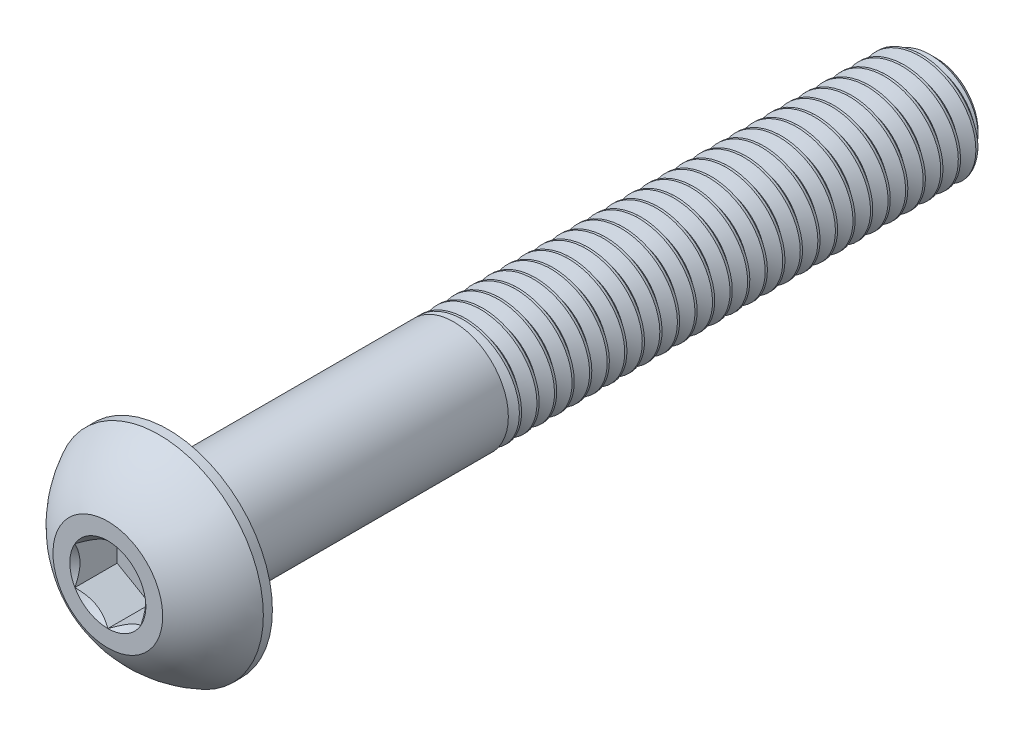
from build123d import *
from build123d.topology import SkipClean

# Parameters (mm, degrees)
SKETCH1_W           = 35
SKETCH1_H           = 2.5
CHAMFER1_SIZE       = 0.6
CUT_SWEEP1_PITCH    = 0.8
CUT_EXTRUDE2_DEPTH  = 1.925
BOSS_EXTRUDE2_START = -13
SKETCH9_R           = 2.5
BOSS_EXTRUDE2_DEPTH = 13


with BuildPart() as part:
    # Sketch1 → Revolve1 (revolve)
    with BuildSketch(Plane(origin=(0, 0, 0), x_dir=(0, 0, -1), z_dir=(1, 0, 0))):
        with Locations((20.25, 1.25)):
            Rectangle(SKETCH1_W, SKETCH1_H)
    revolve(axis=Axis((0, 0, -37.75), (0, 0, 1)))

    # Chamfer1
    chamfer1_edges = [part.edges().sort_by_distance(p)[0] for p in [
        (0, -2.5, -37.75),
    ]]
    chamfer(chamfer1_edges, length=CHAMFER1_SIZE)

    # Cut-Sweep1: arcs per turn and ends read off the stored shape
    # Cut-Sweep1: the profile of Sketch2 profile screwed along a right-hand helix through 44.75 turns, 8 arcs to a turn; built about Z, then put on its axis
    cut_sweep1_z = Axis((0, 0, 0), (0, 0, 1))
    cut_sweep1_corners = [(2.5003, 0, 0.000173205), (2.5003, 0, -0.700173205), (1.980384758, 0, -0.4), (1.980384758, 0, -0.3)]
    with BuildLine(mode=Mode.PRIVATE) as cut_sweep1_profile:
        Line(cut_sweep1_corners[0], cut_sweep1_corners[1])
        Line(cut_sweep1_corners[1], cut_sweep1_corners[2])
        Line(cut_sweep1_corners[2], cut_sweep1_corners[3])
        Line(cut_sweep1_corners[3], cut_sweep1_corners[0])
    cut_sweep1_cap = Face(cut_sweep1_profile.wire())
    cut_sweep1_turn_angles = [0, 22.5, 45, 67.5, 90, 112.5, 135, 157.5, 180, 202.5, 225, 247.5, 270, 292.5, 315, 337.5, 360]
    cut_sweep1_turn_weights = [1, 0.9238795325112867, 1, 0.9238795325112867, 1, 0.9238795325112867, 1, 0.9238795325112867, 1, 0.9238795325112867, 1, 0.9238795325112867, 1, 0.9238795325112867, 1, 0.9238795325112867, 1]
    cut_sweep1_turn_rails = [Edge.make_bspline([Vector(p[0], p[1], 0).rotate(cut_sweep1_z, cut_sweep1_turn_angles[k]) / cut_sweep1_turn_weights[k] + Vector(0, 0, p[2] + CUT_SWEEP1_PITCH * cut_sweep1_turn_angles[k] / 360) for k in range(17)], [0, 0, 0, 1, 1, 2, 2, 3, 3, 4, 4, 5, 5, 6, 6, 7, 7, 8, 8, 8], 2, cut_sweep1_turn_weights) for p in cut_sweep1_corners]
    cut_sweep1_turn_sides = [Face.make_surface_from_curves(cut_sweep1_turn_rails[p[0]], cut_sweep1_turn_rails[p[1]]) for p in [(0, 1), (1, 2), (2, 3), (3, 0)]]
    cut_sweep1_last_angles = [15840, 15862.5, 15885, 15907.5, 15930, 15952.5, 15975, 15997.5, 16020, 16042.5, 16065, 16087.5, 16110]
    cut_sweep1_last_weights = [1, 0.9238795325112867, 1, 0.9238795325112867, 1, 0.9238795325112867, 1, 0.9238795325112867, 1, 0.9238795325112867, 1, 0.923879532511633, 1]
    cut_sweep1_last_rails = [Edge.make_bspline([Vector(p[0], p[1], 0).rotate(cut_sweep1_z, cut_sweep1_last_angles[k]) / cut_sweep1_last_weights[k] + Vector(0, 0, p[2] + CUT_SWEEP1_PITCH * cut_sweep1_last_angles[k] / 360) for k in range(13)], [0, 0, 0, 1, 1, 2, 2, 3, 3, 4, 4, 5, 5, 6, 6, 6], 2, cut_sweep1_last_weights) for p in cut_sweep1_corners]
    cut_sweep1_last_sides = [Face.make_surface_from_curves(cut_sweep1_last_rails[p[0]], cut_sweep1_last_rails[p[1]]) for p in [(0, 1), (1, 2), (2, 3), (3, 0)]]
    cut_sweep1 = Plane(origin=(0, 0, -37.75), x_dir=(0, 1, 0), z_dir=(0, 0, 1)) * Solid(Shell([*[p.moved(Location((0, 0, CUT_SWEEP1_PITCH * i))) for i in range(44) for p in cut_sweep1_turn_sides], *cut_sweep1_last_sides, cut_sweep1_cap, cut_sweep1_cap.rotate(cut_sweep1_z, 16110).moved(Location((0, 0, CUT_SWEEP1_PITCH * 16110 / 360)))]))
    add(cut_sweep1, mode=Mode.SUBTRACT)

    # Sketch7 → Revolve2 (revolve)
    with BuildSketch(Plane(origin=(0, 0, 0), x_dir=(0, 0, -1), z_dir=(1, 0, 0))):
        with BuildLine():
            Line((2.3375, 4.75), (2.75, 4.75))
            Line((2.75, 4.75), (2.75, 0))
            Line((2.75, 0), (0, 0))
            Line((0, 0), (0, 2.5))
            ThreePointArc((0, 2.5), (0.991875183, 3.808753282), (2.3375, 4.75))
        make_face()
    revolve(axis=Axis((0, 0, 0), (0, 0, -1)))

    # Sketch5 → Cut-Extrude2 (cut)
    with BuildSketch(Plane.XY):
        Polygon((1.5, -0.866025404), (1.5, 0.866025404), (0, 1.732050808), (-1.5, 0.866025404), (-1.5, -0.866025404), (0, -1.732050808), align=None)
    extrude(amount=-CUT_EXTRUDE2_DEPTH, mode=Mode.SUBTRACT)

    # Cut-Extrude3 cone 1 section (through the dimple's axis) → Cut-Extrude3 (revolve, cut)
    with BuildSketch(Plane(origin=(0, 0, 0), x_dir=(0, -1, 0), z_dir=(1, 0, 0))):
        Polygon((0, 0), (1.732050808, 0), (0, 1.732050808), align=None)
    revolve(axis=Axis((0, 0, 0), (0, 0, -1)), mode=Mode.SUBTRACT)

    # Sketch9 → Boss-Extrude2 (add)
    with SkipClean():  # the faces are left unmerged after this step: merging them gives an invalid solid
        with BuildSketch(Plane.XY.offset(-2.75).offset(BOSS_EXTRUDE2_START)):
            with Locations(Location((0, 0, 0), (0, 0, 90))):
                Circle(SKETCH9_R)
        extrude(amount=BOSS_EXTRUDE2_DEPTH)


solid = part.part
